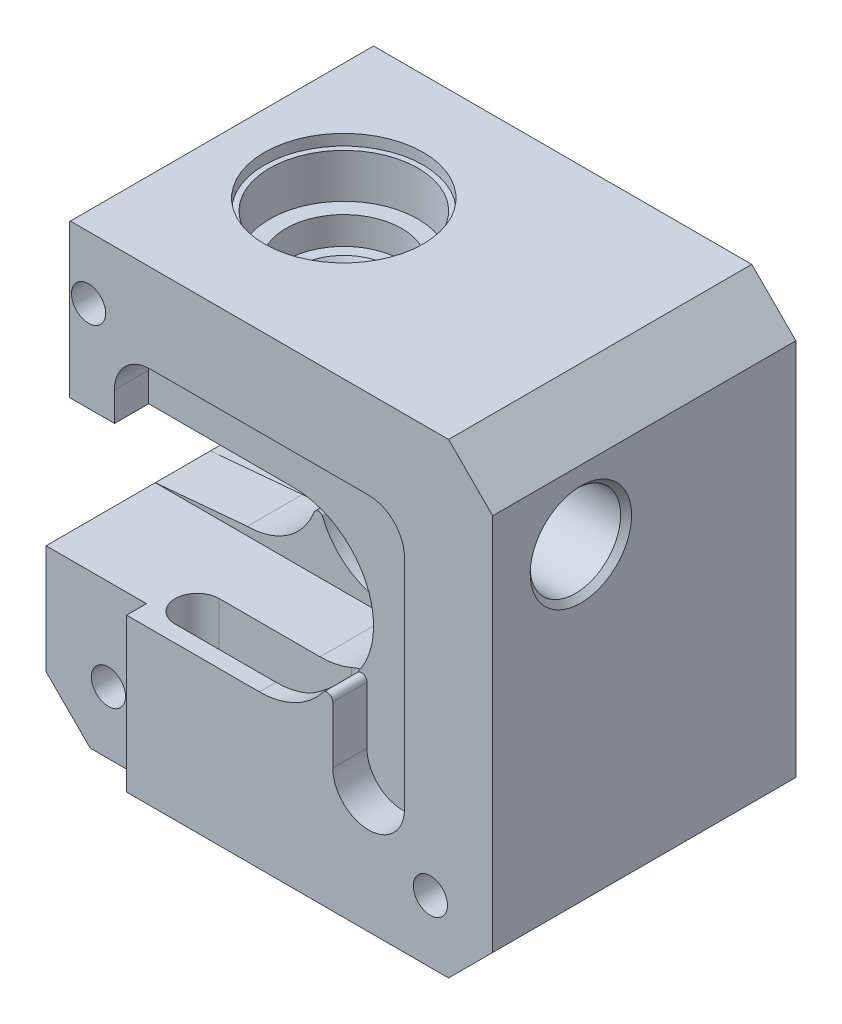
from build123d import *

# Parameters (mm, degrees)
CROQUIS1_W              = 42.3
CROQUIS1_H              = 42.3
SALIENTE_EXTRUIR1_DEPTH = 28
CHAFL_N1_SIZE           = 4
CROQUIS5_W              = 28.4
CROQUIS5_H              = 14.5
CORTAR_EXTRUIR4_DEPTH   = 28
CROQUIS6_W              = 5
CROQUIS6_H              = 14.5
SALIENTE_EXTRUIR2_DEPTH = 28.4
CORTAR_EXTRUIR5_REACH   = 64.109
CROQUIS3_R              = 1.9
CORTAR_EXTRUIR2_DEPTH   = 67.049829674
CORTAR_EXTRUIR6_DEPTH   = 20
CROQUIS9_R              = 1.55
CORTAR_EXTRUIR7_DEPTH   = 28
CROQUIS10_R             = 6.725
CORTAR_EXTRUIR8_DEPTH   = 5
CROQUIS11_R             = 5.25
CORTAR_EXTRUIR9_DEPTH   = 2.5
CROQUIS12_R             = 3.25
CORTAR_EXTRUIR10_DEPTH  = 6
CROQUIS15_R             = 7.2
CORTAR_EXTRUIR13_DEPTH  = 1
CHAFL_N2_SIZE           = 1
CHAFL_N2_SIZE2          = 1.732050808
CHAFL_N4_SIZE           = 1
CHAFL_N4_SIZE2          = 1.732050808
CHAFL_N5_SIZE           = 0.7
CHAFL_N5_SIZE2          = 1.212435565
CORTAR_EXTRUIR17_START  = -28.4
CORTAR_EXTRUIR17_DEPTH  = 13.9
CROQUIS21_W             = 0.6029178
CROQUIS21_H             = 4.2
CORTAR_EXTRUIR19_DEPTH  = 63.108534035
CROQUIS22_R             = 2.5
CORTAR_EXTRUIR20_DEPTH  = 67.049829674
REDONDEO1_R             = 0.4
CROQUIS25_W             = 42.3
CROQUIS25_H             = 0.5
CORTAR_EXTRUIR23_DEPTH  = 67.049829674
CROQUIS34_W             = 1.8
CROQUIS34_H             = 13.9
CROQUIS34_W_2           = 4.5
CORTAR_EXTRUIR28_DEPTH  = 9.1
REDONDEO6_START         = 5.5
REDONDEO6_DEPTH         = 22
REDONDEO6_2_DEPTH       = 10.464246
REDONDEO6_3_DEPTH       = 1.5
REDONDEO6_START_2       = 13.9
REDONDEO6_4_DEPTH       = 1.861113622
REDONDEO6_START_3       = 1.5
REDONDEO6_5_DEPTH       = 4
REDONDEO6_6_DEPTH       = 4
CORTAR_EXTRUIR29_DEPTH  = 3.9
REDONDEO7_R             = 2
CROQUIS24_R             = 4.1
CORTAR_EXTRUIR22_DEPTH  = 17
CHAFL_N7_SIZE           = 0.5
CORTAR_EXTRUIR30_START  = -3.1
CORTAR_EXTRUIR30_DEPTH  = 3.1
REDONDEO10_R            = 0.5


with BuildPart() as part:
    # Croquis1 → Saliente-Extruir1 (new body)
    with BuildSketch(Plane.XY):
        with Locations((21.15, 21.15)):
            Rectangle(CROQUIS1_W, CROQUIS1_H)
    extrude(amount=SALIENTE_EXTRUIR1_DEPTH)

    # Chaflán1
    chafl_n1_edges = [part.edges().sort_by_distance(p)[0] for p in [
        (0, 42.3, 14),
        (42.3, 42.3, 14),
        (42.3, 0, 14),
        (0, 0, 14),
    ]]
    chamfer(chafl_n1_edges, length=CHAFL_N1_SIZE)

    # Croquis5 → Cortar-Extruir4 (cut)
    with BuildSketch(Plane.XY.offset(28)):
        with Locations((14.2, 21.15)):
            Rectangle(CROQUIS5_W, CROQUIS5_H)
    extrude(amount=-CORTAR_EXTRUIR4_DEPTH, mode=Mode.SUBTRACT)

    # Croquis6 → Saliente-Extruir2 (add)
    with BuildSketch(Plane.ZY):
        with Locations((14.2, 21.15)):
            Rectangle(CROQUIS6_W, CROQUIS6_H)
    extrude(amount=-SALIENTE_EXTRUIR2_DEPTH)

    # Croquis7 → Cortar-Extruir5 (cut, up to next)
    with BuildSketch(Plane.XY.offset(16.7), mode=Mode.PRIVATE) as cortar_extruir5_sk1:
        with BuildLine():
            Line((0, 27.65), (8.35, 27.65))
            ThreePointArc((8.35, 27.65), (12.577883631, 26.087104415), (14.772616289, 22.15))
            Line((14.772616289, 22.15), (14.828607748, 22.15))
            ThreePointArc((14.828607748, 22.15), (27.55, 21.15), (14.828607748, 20.15))
            Line((14.828607748, 20.15), (14.772616289, 20.15))
            ThreePointArc((14.772616289, 20.15), (12.577883631, 16.212895585), (8.35, 14.65))
            Line((8.35, 14.65), (0, 14.65))
            ThreePointArc((0, 14.65), (-6.5, 21.15), (0, 27.65))
        make_face()
    cortar_extruir5_tool1 = extrude(cortar_extruir5_sk1.sketch, amount=-CORTAR_EXTRUIR5_REACH, mode=Mode.PRIVATE) & part.part
    add(cortar_extruir5_tool1.solids().sort_by_distance((10.077992, 21.15, 16.7))[0], mode=Mode.SUBTRACT)

    # Croquis3 → Cortar-Extruir2 (cut, through all)
    with BuildSketch(Plane(origin=(0, 42.3, 0), x_dir=(1, 0, 0), z_dir=(0, 1, 0))):
        with Locations(Location((14.6, -14.2, 0), (0, 0, 270))):
            Circle(CROQUIS3_R)
    extrude(amount=-CORTAR_EXTRUIR2_DEPTH, mode=Mode.SUBTRACT)

    # Croquis8 → Cortar-Extruir6 (cut)
    with BuildSketch(Plane(origin=(0, 0, 11.7), x_dir=(-1, 0, 0), z_dir=(0, 0, -1))):
        Polygon((-8.35, 14.65), (0, 13.9), (0, 14.65), align=None)
        Polygon((0, 28.4), (-8.35, 27.65), (0, 27.65), align=None)
    extrude(amount=-CORTAR_EXTRUIR6_DEPTH, mode=Mode.SUBTRACT)

    # Croquis9 → Cortar-Extruir7 (cut)
    with BuildSketch(Plane(origin=(0, 0, 0), x_dir=(-1, 0, 0), z_dir=(0, 0, -1))):
        with Locations((-5.65, 36.65)):
            Circle(CROQUIS9_R)
        with Locations((-5.65, 5.65)):
            Circle(CROQUIS9_R)
        with Locations((-36.65, 5.65)):
            Circle(CROQUIS9_R)
    extrude(amount=-CORTAR_EXTRUIR7_DEPTH, mode=Mode.SUBTRACT)

    # Croquis10 → Cortar-Extruir8 (cut)
    with BuildSketch(Plane(origin=(0, 42.3, 0), x_dir=(1, 0, 0), z_dir=(0, 1, 0))):
        with Locations(Location((14.6, -14.2, 0), (0, 0, 270))):
            Circle(CROQUIS10_R)
    cortar_extruir8 = extrude(amount=-CORTAR_EXTRUIR8_DEPTH, mode=Mode.SUBTRACT)

    # Croquis11 → Cortar-Extruir9 (cut)
    with BuildSketch(Plane(origin=(0, 37.3, 0), x_dir=(1, 0, 0), z_dir=(0, 1, 0))):
        with Locations(Location((14.6, -14.2, 0), (0, 0, 270))):
            Circle(CROQUIS11_R)
    cortar_extruir9 = extrude(amount=-CORTAR_EXTRUIR9_DEPTH, mode=Mode.SUBTRACT)

    # Croquis12 → Cortar-Extruir10 (cut)
    with BuildSketch(Plane(origin=(0, 34.8, 0), x_dir=(1, 0, 0), z_dir=(0, 1, 0))):
        with Locations(Location((14.6, -14.2, 0), (0, 0, 270))):
            Circle(CROQUIS12_R)
    cortar_extruir10 = extrude(amount=-CORTAR_EXTRUIR10_DEPTH, mode=Mode.SUBTRACT)

    # Croquis15 → Cortar-Extruir13 (cut)
    with BuildSketch(Plane(origin=(0, 42.3, 0), x_dir=(1, 0, 0), z_dir=(0, 1, 0))):
        with Locations(Location((14.6, -14.2, 0), (0, 0, 270))):
            Circle(CROQUIS15_R)
    cortar_extruir13 = extrude(amount=-CORTAR_EXTRUIR13_DEPTH, mode=Mode.SUBTRACT)

    # Chaflán2
    chafl_n2_edges = [part.edges().sort_by_distance(p)[0] for p in [
        (14.6, 34.8, 10.95),
    ]]
    chafl_n2_side = [part.faces().sort_by_distance(p)[0] for p in [
        (14.6, 34.8, 9.098492424),
    ]]
    chamfer(chafl_n2_edges, length=CHAFL_N2_SIZE, length2=CHAFL_N2_SIZE2, reference=chafl_n2_side[0])

    # Simetría1: Cortar-Extruir8, Cortar-Extruir9, Cortar-Extruir10, Cortar-Extruir13 across plane
    add(cortar_extruir8.mirror(Plane.ZX.offset(21.15)), mode=Mode.SUBTRACT)
    add(cortar_extruir9.mirror(Plane.ZX.offset(21.15)), mode=Mode.SUBTRACT)
    add(cortar_extruir10.mirror(Plane.ZX.offset(21.15)), mode=Mode.SUBTRACT)
    add(cortar_extruir13.mirror(Plane.ZX.offset(21.15)), mode=Mode.SUBTRACT)

    # Chaflán4
    chafl_n4_edges = [part.edges().sort_by_distance(p)[0] for p in [
        (14.6, 7.5, 10.95),
    ]]
    chafl_n4_side = [part.faces().sort_by_distance(p)[0] for p in [
        (14.6, 7.5, 9.098492424),
    ]]
    chamfer(chafl_n4_edges, length=CHAFL_N4_SIZE, length2=CHAFL_N4_SIZE2, reference=chafl_n4_side[0])

    # Chaflán5
    chafl_n5_edges = [part.edges().sort_by_distance(p)[0] for p in [
        (14.6, 13.5, 12.3),
    ]]
    chafl_n5_side = [part.faces().sort_by_distance(p)[0] for p in [
        (14.6, 13.5, 11.041923882),
    ]]
    chamfer(chafl_n5_edges, length=CHAFL_N5_SIZE, length2=CHAFL_N5_SIZE2, reference=chafl_n5_side[0])

    # Croquis18 → Cortar-Extruir17 (cut)
    with BuildSketch(Plane(origin=(0, 42.3, 0), x_dir=(1, 0, 0), z_dir=(0, 1, 0)).offset(CORTAR_EXTRUIR17_START)):
        with BuildLine():
            Line((12, -5.5), (24, -5.5))
            ThreePointArc((24, -5.5), (26, -3.5), (24, -1.5))
            Line((24, -1.5), (12, -1.5))
            ThreePointArc((12, -1.5), (10, -3.5), (12, -5.5))
        make_face()
    extrude(amount=-CORTAR_EXTRUIR17_DEPTH, mode=Mode.SUBTRACT)

    # Croquis21 → Cortar-Extruir19 (cut, through all)
    with BuildSketch(Plane.XY.offset(16.7)):
        with Locations((14.8028815, 21.15)):
            Rectangle(CROQUIS21_W, CROQUIS21_H)
    extrude(amount=-CORTAR_EXTRUIR19_DEPTH, mode=Mode.SUBTRACT)

    # Croquis22 → Cortar-Extruir20 (cut, through all)
    with BuildSketch(Plane.ZY):
        with Locations(Location((8, 32.05, 0), (0, 0, 270))):
            Circle(CROQUIS22_R)
    extrude(amount=-CORTAR_EXTRUIR20_DEPTH, mode=Mode.SUBTRACT)

    # Redondeo1
    # the kernel refuses this fillet: 0.4 mm, written as the material it takes off along each edge
    with BuildSketch(Plane(origin=(14.5014226, 19.05, 13.001937654), x_dir=(1, 0, 0), z_dir=(0, 0, -1))) as redondeo1_piece_1:
        with BuildLine():
            CenterArc((0.279751477, 0.4), REDONDEO1_R, 201.242672427, 68.757327573)
            ThreePointArc((-0.093070209, 0.255072464), (-0.04520308, 0.128022258), (0, 0))
            Line((0, 0), (0.279751477, 0))
        make_face()
    extrude(amount=2.001316345, mode=Mode.SUBTRACT)
    with BuildSketch(Plane(origin=(15.1043404, 19.05, 13.063421956), x_dir=(0.3479633367587748, -0.9375081419762173, 0), z_dir=(0, 0, -1))) as redondeo1_piece_2:
        with BuildLine():
            CenterArc((0.278232878, 0.399911132), REDONDEO1_R, 200.362794187, 68.429421699)
            Line((-0.096770379, 0.260725797), (0, 0))
            ThreePointArc((0, 0), (0.134900789, 0.001421894), (0.269801578, 0))
        make_face()
    extrude(amount=2.058684709, mode=Mode.SUBTRACT)
    with BuildSketch(Plane(origin=(15.1043404, 19.05, 17.395262754), x_dir=(-1, 0, 0), z_dir=(0, 0, -1))) as redondeo1_piece_3:
        with BuildLine():
            CenterArc((0.278105101, -0.4), REDONDEO1_R, 90, 68.429421698)
            ThreePointArc((-0.093881057, -0.252941176), (-0.045607491, -0.126965355), (0, 0))
            Line((0, 0), (0.278105101, 0))
        make_face()
    extrude(amount=2.058684708, mode=Mode.SUBTRACT)
    with BuildSketch(Plane(origin=(14.5014226, 19.05, 17.399378692), x_dir=(1, 0, 0), z_dir=(0, 0, -1))) as redondeo1_piece_4:
        with BuildLine():
            CenterArc((0.279751477, 0.4), REDONDEO1_R, 201.242672427, 68.757327573)
            ThreePointArc((-0.093070209, 0.255072464), (-0.04520308, 0.128022258), (0, 0))
            Line((0, 0), (0.279751477, 0))
        make_face()
    extrude(amount=2.001316321, mode=Mode.SUBTRACT)
    with BuildSketch(Plane(origin=(15.1043404, 23.25, 17.395262754), x_dir=(0.34796333675886587, 0.9375081419761836, 0), z_dir=(0, 0, -1))) as redondeo1_piece_5:
        with BuildLine():
            CenterArc((0.278232878, -0.399911132), REDONDEO1_R, 91.207784114, 68.429421699)
            Line((-0.096770379, -0.260725797), (0, 0))
            ThreePointArc((0, 0), (0.134900789, -0.001421894), (0.269801578, 0))
        make_face()
    extrude(amount=2.058684708, mode=Mode.SUBTRACT)
    with BuildSketch(Plane(origin=(15.1043404, 23.25, 13.063421956), x_dir=(0.34796333675886587, 0.9375081419761836, 0), z_dir=(0, 0, -1))) as redondeo1_piece_6:
        with BuildLine():
            CenterArc((0.278232878, -0.399911132), REDONDEO1_R, 91.207784114, 68.429421699)
            Line((-0.096770379, -0.260725797), (0, 0))
            ThreePointArc((0, 0), (0.134900789, -0.001421894), (0.269801578, 0))
        make_face()
    extrude(amount=2.058684709, mode=Mode.SUBTRACT)
    with BuildSketch(Plane(origin=(14.5014226, 23.25, 13.001937654), x_dir=(1, 0, 0), z_dir=(0, 0, -1))) as redondeo1_piece_7:
        with BuildLine():
            CenterArc((0.279751477, -0.4), REDONDEO1_R, 90, 68.757327573)
            ThreePointArc((-0.093070209, -0.255072464), (-0.04520308, -0.128022258), (0, 0))
            Line((0, 0), (0.279751477, 0))
        make_face()
    extrude(amount=2.001316345, mode=Mode.SUBTRACT)
    with BuildSketch(Plane(origin=(14.5014226, 23.25, 17.399378692), x_dir=(1, 0, 0), z_dir=(0, 0, -1))) as redondeo1_piece_8:
        with BuildLine():
            CenterArc((0.279751477, -0.4), REDONDEO1_R, 90, 68.757327573)
            ThreePointArc((-0.093070209, -0.255072464), (-0.04520308, -0.128022258), (0, 0))
            Line((0, 0), (0.279751477, 0))
        make_face()
    extrude(amount=2.001316321, mode=Mode.SUBTRACT)

    # Croquis25 → Cortar-Extruir23 (cut, through all)
    with BuildSketch(Plane(origin=(0, 42.3, 0), x_dir=(1, 0, 0), z_dir=(0, 1, 0))):
        with Locations((21.15, -27.75)):
            Rectangle(CROQUIS25_W, CROQUIS25_H)
    extrude(amount=-CORTAR_EXTRUIR23_DEPTH, mode=Mode.SUBTRACT)

    # Croquis34 → Cortar-Extruir28 (cut)
    with BuildSketch(Plane.ZY):
        with Locations((0.9, 6.95)):
            Rectangle(CROQUIS34_W, CROQUIS34_H)
        with Locations((22.05, 6.95)):
            Rectangle(CROQUIS34_W_2, CROQUIS34_H)
    extrude(amount=-CORTAR_EXTRUIR28_DEPTH, mode=Mode.SUBTRACT)

    # Redondeo6: read off the stored shape, not the designer's step
    # Redondeo6 outline → Redondeo6 (add)
    with BuildSketch(Plane.XY.offset(REDONDEO6_START)):
        with BuildLine():
            Line((28.4, 13.9), (28.4, 21.15))
            ThreePointArc((28.4, 21.15), (26.276524164, 16.023475836), (21.15, 13.9))
            Line((21.15, 13.9), (28.4, 13.9))
        make_face()
        with BuildLine():
            ThreePointArc((21.15, 28.4), (26.276524164, 26.276524164), (28.4, 21.15))
            Line((28.4, 21.15), (28.4, 28.4))
            Line((28.4, 28.4), (21.15, 28.4))
        make_face()
    extrude(amount=REDONDEO6_DEPTH)

    # Redondeo6 2 outline → Redondeo6 2 (add)
    with BuildSketch(Plane.XY):
        with BuildLine():
            ThreePointArc((21.15, 28.4), (26.276524164, 26.276524164), (28.4, 21.15))
            Line((28.4, 21.15), (28.4, 28.4))
            Line((28.4, 28.4), (21.15, 28.4))
        make_face()
    extrude(amount=REDONDEO6_2_DEPTH)

    # Redondeo6 3 outline → Redondeo6 3 (add)
    with BuildSketch(Plane.XY):
        with BuildLine():
            Line((28.4, 13.9), (28.4, 21.15))
            ThreePointArc((28.4, 21.15), (26.276524164, 16.023475836), (21.15, 13.9))
            Line((21.15, 13.9), (28.4, 13.9))
        make_face()
    extrude(amount=REDONDEO6_3_DEPTH)

    # Redondeo6 4 outline → Redondeo6 4 (add)
    with BuildSketch(Plane(origin=(0, 0, 0), x_dir=(1, 0, 0), z_dir=(0, 1, 0)).offset(REDONDEO6_START_2)):
        with BuildLine():
            ThreePointArc((24, -1.5), (26, -3.5), (24, -5.5))
            Line((24, -5.5), (28.4, -5.5))
            Line((28.4, -5.5), (28.4, -1.5))
            Line((28.4, -1.5), (24, -1.5))
        make_face()
    extrude(amount=REDONDEO6_4_DEPTH)

    # Redondeo6 5 outline → Redondeo6 5 (cut)
    with BuildSketch(Plane.XY.offset(REDONDEO6_START_3)):
        with BuildLine():
            ThreePointArc((23, 14.140007132), (24.596659727, 14.771674457), (25.999990063, 15.761113622))
            Line((25.999990063, 15.761113622), (23, 15.761113622))
            Line((23, 15.761113622), (23, 14.140007132))
        make_face()
    extrude(amount=REDONDEO6_5_DEPTH, mode=Mode.SUBTRACT)

    # Redondeo6 6 outline → Redondeo6 6 (add)
    with BuildSketch(Plane.XY.offset(REDONDEO6_START_3)):
        with BuildLine():
            Line((28.4, 15.761113622), (28.4, 21.15))
            ThreePointArc((28.4, 21.15), (27.772874299, 18.200417653), (25.999990063, 15.761113622))
            Line((25.999990063, 15.761113622), (28.4, 15.761113622))
        make_face()
    extrude(amount=REDONDEO6_6_DEPTH)

    # Croquis35 → Cortar-Extruir29 (cut)
    with BuildSketch(Plane.ZY):
        with BuildLine():
            Line((24.7, 27.4), (24.7, 29.15))
            ThreePointArc((24.7, 29.15), (22.21040764, 35.16040764), (16.2, 37.65))
            Line((16.2, 37.65), (12.7, 37.65))
            Line((12.7, 37.65), (12.7, 42.3))
            Line((12.7, 42.3), (0, 42.3))
            Line((0, 42.3), (0, 27.4))
            Line((0, 27.4), (24.7, 27.4))
        make_face()
    extrude(amount=-CORTAR_EXTRUIR29_DEPTH, mode=Mode.SUBTRACT)

    # Redondeo7
    redondeo7_edges = [part.edges().sort_by_distance(p)[0] for p in [
        (1.95, 37.65, 12.7),
    ]]
    fillet(redondeo7_edges, radius=REDONDEO7_R)

    # Croquis24 → Cortar-Extruir22 (cut)
    with BuildSketch(Plane(origin=(42.3, 0, 0), x_dir=(0, 0, -1), z_dir=(1, 0, 0))):
        with Locations(Location((-8, 32.05, 0), (0, 0, 90))):
            Circle(CROQUIS24_R)
    extrude(amount=-CORTAR_EXTRUIR22_DEPTH, mode=Mode.SUBTRACT)

    # Chaflán7
    chafl_n7_edges = [part.edges().sort_by_distance(p)[0] for p in [
        (42.3, 27.95, 8),
    ]]
    chamfer(chafl_n7_edges, length=CHAFL_N7_SIZE)

    # Cortar-Extruir30: read off the stored shape, not the designer's step
    # Cortar-Extruir30 outline → Cortar-Extruir30 (cut)
    with BuildSketch(Plane(origin=(0, 0, 0), x_dir=(-1, 0, 0), z_dir=(0, 0, -1)).offset(CORTAR_EXTRUIR30_START)):
        with BuildLine():
            ThreePointArc((-31.049494937, 34.299494937), (-33.347591975, 33.347591975), (-34.299494937, 31.049494937))
            Line((-34.299494937, 31.049494937), (-34.299494937, 11.250505063))
            ThreePointArc((-34.299494937, 11.250505063), (-31.049494937, 8.000505063), (-27.799494937, 11.250505063))
            Line((-27.799494937, 11.250505063), (-27.799494937, 18.26093145))
            ThreePointArc((-27.799494937, 18.26093145), (-28.248286353, 19.674591292), (-28.4, 21.15))
            ThreePointArc((-28.4, 21.15), (-26.276524164, 26.276524164), (-21.15, 28.4))
            Line((-21.15, 28.4), (-8.000505063, 28.4))
            Line((-8.000505063, 28.4), (-8.000505063, 31.049494937))
            ThreePointArc((-8.000505063, 31.049494937), (-8.952408025, 33.347591975), (-11.250505063, 34.299494937))
            Line((-11.250505063, 34.299494937), (-31.049494937, 34.299494937))
        make_face()
    extrude(amount=CORTAR_EXTRUIR30_DEPTH, mode=Mode.SUBTRACT)

    # Redondeo10
    redondeo10_edges = [part.edges().sort_by_distance(p)[0] for p in [
        (27.799494937, 18.26093145, 2.3),
    ]]
    fillet(redondeo10_edges, radius=REDONDEO10_R)


with BuildPart() as body_2:
    # Simetría2: mirrored copy
    add(part.part.mirror(Plane(origin=(0, 0, 13.75), x_dir=(1, 0, 0), z_dir=(0, 0, -1))))


solid = body_2.part
